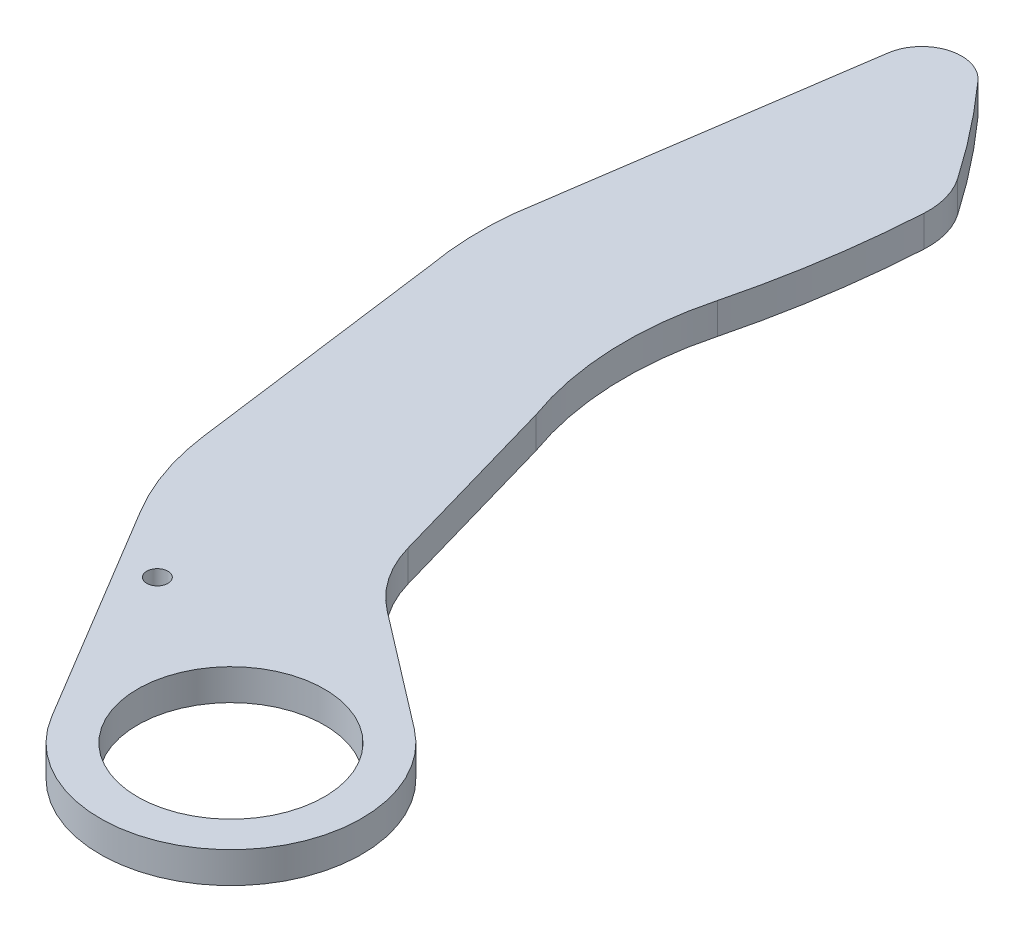
from build123d import *

# Parameters (mm, degrees)
SKETCH1_R           = 15
SKETCH1_R_2         = 1.7
BOSS_EXTRUDE2_DEPTH = 5


with BuildPart() as part:
    # Sketch1 → Boss-Extrude2 (new body)
    with BuildSketch(Plane(origin=(0, 0, 0), x_dir=(1, 0, 0), z_dir=(0, 1, 0))):
        with BuildLine():
            Line((12.766893669, 16.673524704), (-5.806288098, 30.894983029))
            ThreePointArc((-5.806288098, 30.894983029), (-10.173884932, 35.51072238), (-12.873087905, 41.263569952))
            Line((-12.873087905, 41.263569952), (-21.139528525, 70.102189189))
            ThreePointArc((-21.139528525, 70.102189189), (-24.1253581, 85.250444887), (-22.456551163, 100.599709115))
            ThreePointArc((-22.456551163, 100.599709115), (-19.558480324, 114.843106453), (-18.020623668, 129.29676271))
            ThreePointArc((-18.020623668, 129.29676271), (-18.441772746, 133.226047543), (-20.116399197, 136.805470974))
            ThreePointArc((-20.116399197, 136.805470974), (-25.866377757, 144.615905974), (-32.098124488, 152.047627243))
            ThreePointArc((-32.098124488, 152.047627243), (-38.706331156, 153.910886754), (-43.194615771, 148.715173848))
            Line((-43.194615771, 148.715173848), (-50.932711484, 96.056215067))
            ThreePointArc((-50.932711484, 96.056215067), (-51.118515181, 89.191813761), (-50.383474997, 82.364351257))
            Line((-50.383474997, 82.364351257), (-44.824882263, 40.292034954))
            ThreePointArc((-44.824882263, 40.292034954), (-42.933064202, 32.343713579), (-39.465684055, 24.945601445))
            Line((-39.465684055, 24.945601445), (-18.005501401, -10.807493664))
            ThreePointArc((-18.005501401, -10.807493664), (13.987935708, -15.66325811), (12.766893669, 16.673524704))
        make_face()
        Circle(SKETCH1_R, mode=Mode.SUBTRACT)
        with Locations((-28.941809346, 17.128095976)):
            Circle(SKETCH1_R_2, mode=Mode.SUBTRACT)
    extrude(amount=BOSS_EXTRUDE2_DEPTH)


solid = part.part
